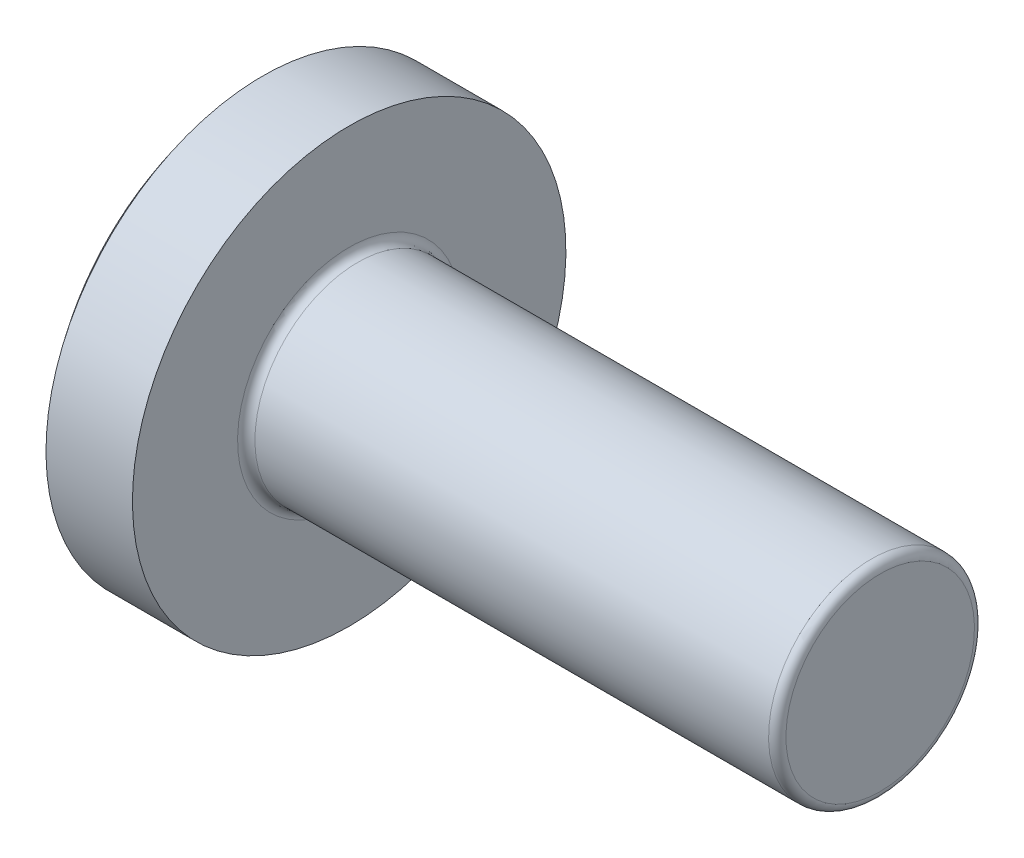
from build123d import *

# Parameters (mm, degrees)
CUT_EXTRUDE1_DEPTH = 5.2
FILLET1_R          = 0.4
DRAFT1_ANGLE       = -30


with BuildPart() as part:
    # Sketch1 → Base (revolve)
    with BuildSketch(Plane.XY):
        with BuildLine():
            Line((32, 0), (32, 4.75))
            Line((32, 4.75), (7.5, 4.75))
            Line((7.5, 4.75), (7.5, 10))
            Line((7.5, 10), (3.510004003, 10))
            ThreePointArc((3.510004003, 10), (0.902981487, 5.299059542), (0, 0))
            Line((0, 0), (32, 0))
        make_face()
    revolve(axis=Axis((-8.635649275, 0, 0), (1, 0, 0)))

    # Sketch2 → Cut-Extrude1 (cut)
    with BuildSketch(Plane(origin=(0, 0, 0), x_dir=(0, 0, -1), z_dir=(1, 0, 0))):
        Polygon((-1.01, 5.05), (1.01, 5.05), (1.01, 1.01), (5.05, 1.01), (5.05, -1.01), (1.01, -1.01), (1.01, -5.05), (-1.01, -5.05), (-1.01, -1.01), (-5.05, -1.01), (-5.05, 1.01), (-1.01, 1.01), align=None)
    extrude(amount=CUT_EXTRUDE1_DEPTH, mode=Mode.SUBTRACT)

    # Fillet1
    fillet1_edges = [part.edges().sort_by_distance(p)[0] for p in [
        (7.5, -4.75, 0),
        (32, -4.75, 0),
    ]]
    fillet(fillet1_edges, radius=FILLET1_R)

    # Draft1
    draft1_faces = [part.faces().sort_by_distance(p)[0] for p in [
        (3.014519397, 5.05, 0),
        (3.014519397, 0, 5.05),
        (3.014519397, -5.05, 0),
        (3.014519397, 0, -5.05),
    ]]
    draft(draft1_faces, Plane(origin=(0, 0, 0), x_dir=(0, 0, 1), z_dir=(1, 0, 0)), DRAFT1_ANGLE)


solid = part.part
